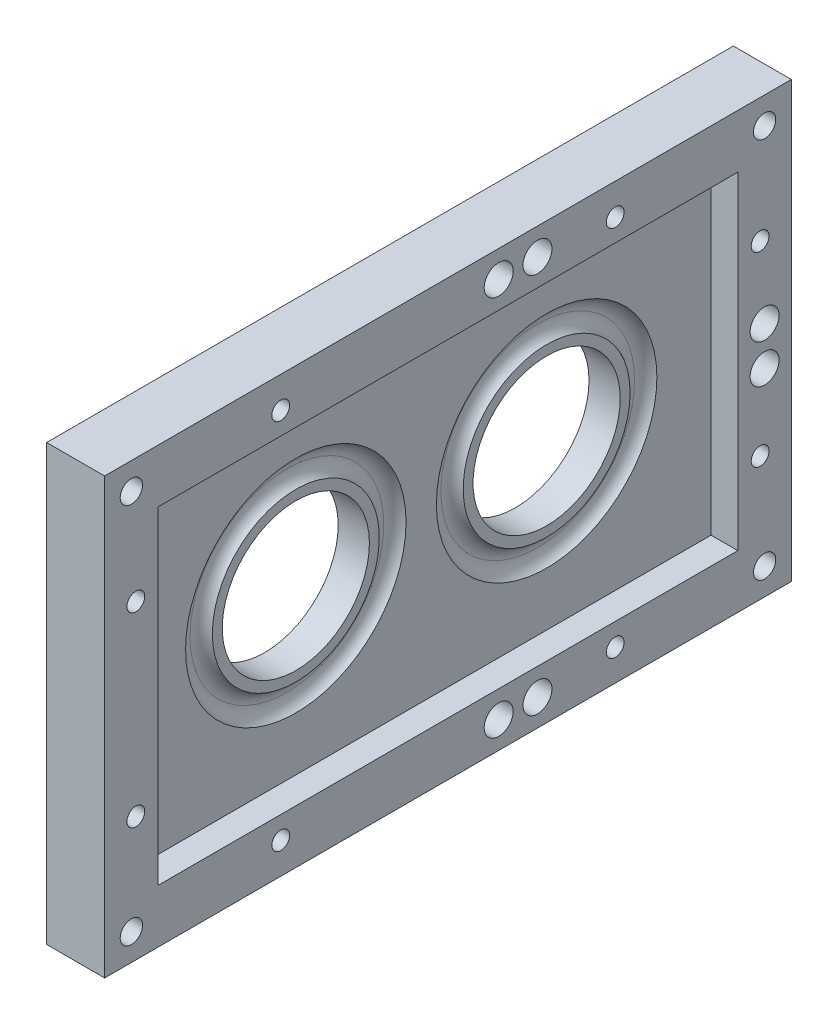
from build123d import *

# Parameters (mm, degrees)
SKETCH1_W           = 130
SKETCH1_H           = 73.5
BOSS_EXTRUDE1_DEPTH = 5
SKETCH2_R           = 24.718
SKETCH2_R_2         = 18.718
CUT_EXTRUDE1_DEPTH  = 2
FILLET1_R           = 3.25
SKETCH3_W           = 10
SKETCH3_H           = 73.5
BOSS_EXTRUDE2_DEPTH = 11
SKETCH4_R           = 2
CUT_EXTRUDE2_DEPTH  = 90.059320119
SKETCH5_R           = 16.5
CUT_EXTRUDE3_DEPTH  = 89.580824674
SKETCH7_W           = 150
SKETCH7_H           = 93.5
SKETCH7_R           = 16.5
SKETCH7_R_2         = 2
BOSS_EXTRUDE3_DEPTH = 2
SKETCH8_R           = 2
CUT_EXTRUDE5_DEPTH  = 90.328396941
SKETCH9_R           = 3.25
CUT_EXTRUDE6_DEPTH  = 6
SKETCH10_W          = 13
SKETCH10_H          = 150
BOSS_EXTRUDE4_DEPTH = 2
SKETCH11_W          = 13
SKETCH11_H          = 150
BOSS_EXTRUDE5_DEPTH = 2
SKETCH12_W          = 13
SKETCH12_H          = 97.5
BOSS_EXTRUDE6_DEPTH = 2
SKETCH13_W          = 13
SKETCH13_H          = 97.5
BOSS_EXTRUDE7_DEPTH = 2
SKETCH14_R          = 2.5
CUT_EXTRUDE7_DEPTH  = 93.057386993
CHAMFER1_SIZE       = 3


with BuildPart() as part:
    # Sketch1 → Boss-Extrude1 (new body)
    with BuildSketch(Plane(origin=(0, 0, 0), x_dir=(0, 0, -1), z_dir=(1, 0, 0))):
        Rectangle(SKETCH1_W, SKETCH1_H)
    extrude(amount=BOSS_EXTRUDE1_DEPTH)

    # Sketch2 → Cut-Extrude1 (cut)
    # profile 1 of 2: a face of its own
    with BuildSketch(Plane(origin=(5, 0, 0), x_dir=(0, 0, -1), z_dir=(1, 0, 0))):
        with Locations((28.125, 0)):
            Circle(SKETCH2_R)
        with Locations((28.125, 0)):
            Circle(SKETCH2_R_2, mode=Mode.SUBTRACT)
    # profile 2 of 2: a face of its own
    with BuildSketch(Plane(origin=(5, 0, 0), x_dir=(0, 0, -1), z_dir=(1, 0, 0))):
        with Locations(Location((-28.125, 0, 0), (0, 0, 180))):
            Circle(SKETCH2_R)
        with Locations(Location((-28.125, 0, 0), (0, 0, 180))):
            Circle(SKETCH2_R_2, mode=Mode.SUBTRACT)
    extrude(amount=-CUT_EXTRUDE1_DEPTH, mode=Mode.SUBTRACT)

    # Fillet1
    # the kernel refuses this fillet: 3.25 mm, written as the material it adds along each edge
    with BuildSketch(Plane(origin=(3, 0, -28.125), x_dir=(0, 0, -1), z_dir=(0, -1, 0))) as fillet1_piece_1:
        with BuildLine():
            CenterArc((21.718, 3.25), FILLET1_R, 270, 67.380135052)
            Line((21.718, 0), (21.718, -0.065))
            Line((21.718, -0.065), (24.718, -0.065))
            Line((24.718, -0.065), (24.783, 0))
            ThreePointArc((24.783, 0), (24.783, 1), (24.778, 1.975))
            Line((24.778, 1.975), (24.718, 2))
        make_face()
    revolve(axis=Axis((3, 0, -28.125), (1, 0, 0)))
    with BuildSketch(Plane(origin=(3, 0, -28.125), x_dir=(0, 0, -1), z_dir=(0, -1, 0))) as fillet1_piece_2:
        with BuildLine():
            CenterArc((21.718, 3.25), FILLET1_R, 202.619864948, 67.380135052)
            Line((18.718, 2), (18.658, 1.975))
            ThreePointArc((18.658, 1.975), (18.653, 1), (18.653, 0))
            Line((18.653, 0), (18.718, -0.065))
            Line((18.718, -0.065), (21.718, -0.065))
            Line((21.718, -0.065), (21.718, 0))
        make_face()
    revolve(axis=Axis((3, 0, -28.125), (1, 0, 0)))
    with BuildSketch(Plane(origin=(3, 0, 28.125), x_dir=(0, 0, 1), z_dir=(0, 1, 0))) as fillet1_piece_3:
        with BuildLine():
            CenterArc((21.718, 3.25), FILLET1_R, 270, 67.380135052)
            Line((21.718, 0), (21.718, -0.065))
            Line((21.718, -0.065), (24.718, -0.065))
            Line((24.718, -0.065), (24.783, 0))
            ThreePointArc((24.783, 0), (24.783, 1), (24.778, 1.975))
            Line((24.778, 1.975), (24.718, 2))
        make_face()
    revolve(axis=Axis((3, 0, 28.125), (1, 0, 0)))
    with BuildSketch(Plane(origin=(3, 0, 28.125), x_dir=(0, 0, 1), z_dir=(0, 1, 0))) as fillet1_piece_4:
        with BuildLine():
            CenterArc((21.718, 3.25), FILLET1_R, 202.619864948, 67.380135052)
            Line((18.718, 2), (18.658, 1.975))
            ThreePointArc((18.658, 1.975), (18.653, 1), (18.653, 0))
            Line((18.653, 0), (18.718, -0.065))
            Line((18.718, -0.065), (21.718, -0.065))
            Line((21.718, -0.065), (21.718, 0))
        make_face()
    revolve(axis=Axis((3, 0, 28.125), (1, 0, 0)))

    # Sketch3 → Boss-Extrude2 (add)
    with BuildSketch(Plane.ZY):
        Polygon((65, 36.75), (75, 36.75), (75, 46.75), (-75, 46.75), (-75, 36.75), (-65, 36.75), align=None)
        with Locations((70, 0)):
            Rectangle(SKETCH3_W, SKETCH3_H)
        Polygon((-65, -36.75), (-75, -36.75), (-75, -46.75), (75, -46.75), (75, -36.75), (65, -36.75), align=None)
        with Locations((-70, 0)):
            Rectangle(SKETCH3_W, SKETCH3_H)
    extrude(amount=-BOSS_EXTRUDE2_DEPTH)

    # Sketch4 → Cut-Extrude2 (cut, through all)
    with BuildSketch(Plane(origin=(11, 0, 0), x_dir=(0, 0, -1), z_dir=(1, 0, 0))):
        with Locations((-37.5, 41.75)):
            Circle(SKETCH4_R)
        with Locations((37.5, 41.75)):
            Circle(SKETCH4_R)
        with Locations((70, 20.875)):
            Circle(SKETCH4_R)
        with Locations(Location((-37.5, -41.75, 0), (0, 0, 180))):
            Circle(SKETCH4_R)
        with Locations(Location((37.5, -41.75, 0), (0, 0, 180))):
            Circle(SKETCH4_R)
        with Locations((70, -20.875)):
            Circle(SKETCH4_R)
        with Locations(Location((-70, 20.875, 0), (0, 0, 180))):
            Circle(SKETCH4_R)
        with Locations(Location((-70, -20.875, 0), (0, 0, 180))):
            Circle(SKETCH4_R)
    extrude(amount=-CUT_EXTRUDE2_DEPTH, mode=Mode.SUBTRACT)

    # Sketch5 → Cut-Extrude3 (cut, through all)
    with BuildSketch(Plane(origin=(5, 0, 0), x_dir=(0, 0, -1), z_dir=(1, 0, 0))):
        with Locations((-28.125, 0)):
            Circle(SKETCH5_R)
        with Locations((28.125, 0)):
            Circle(SKETCH5_R)
    extrude(amount=-CUT_EXTRUDE3_DEPTH, mode=Mode.SUBTRACT)

    # Sketch7 → Boss-Extrude3 (add)
    with BuildSketch(Plane.ZY):
        Rectangle(SKETCH7_W, SKETCH7_H)
        with Locations(Location((28.125, 0, 0), (0, 0, 180))):
            Circle(SKETCH7_R, mode=Mode.SUBTRACT)
        with Locations(Location((-28.125, 0, 0), (0, 0, 180))):
            Circle(SKETCH7_R, mode=Mode.SUBTRACT)
        with Locations(Location((-70, 20.875, 0), (0, 0, 180))):
            Circle(SKETCH7_R_2, mode=Mode.SUBTRACT)
        with Locations(Location((-70, -20.875, 0), (0, 0, 180))):
            Circle(SKETCH7_R_2, mode=Mode.SUBTRACT)
        with Locations((-37.5, -41.75)):
            Circle(SKETCH7_R_2, mode=Mode.SUBTRACT)
        with Locations((37.5, -41.75)):
            Circle(SKETCH7_R_2, mode=Mode.SUBTRACT)
        with Locations((70, -20.875)):
            Circle(SKETCH7_R_2, mode=Mode.SUBTRACT)
        with Locations((70, 20.875)):
            Circle(SKETCH7_R_2, mode=Mode.SUBTRACT)
        with Locations(Location((-37.5, 41.75, 0), (0, 0, 180))):
            Circle(SKETCH7_R_2, mode=Mode.SUBTRACT)
        with Locations(Location((37.5, 41.75, 0), (0, 0, 180))):
            Circle(SKETCH7_R_2, mode=Mode.SUBTRACT)
    extrude(amount=BOSS_EXTRUDE3_DEPTH)

    # Sketch8 → Cut-Extrude5 (cut, through all)
    with BuildSketch(Plane(origin=(11, 0, 0), x_dir=(0, 0, -1), z_dir=(1, 0, 0))):
        with Locations((11.37, 42.75)):
            Circle(SKETCH8_R)
        with Locations((20.07, 42.75)):
            Circle(SKETCH8_R)
        with Locations((11.37, -42.75)):
            Circle(SKETCH8_R)
        with Locations((20.07, -42.75)):
            Circle(SKETCH8_R)
        with Locations((71, 4.35)):
            Circle(SKETCH8_R)
        with Locations((71, -4.35)):
            Circle(SKETCH8_R)
    extrude(amount=-CUT_EXTRUDE5_DEPTH, mode=Mode.SUBTRACT)

    # Sketch9 → Cut-Extrude6 (cut)
    with BuildSketch(Plane(origin=(11, 0, 0), x_dir=(0, 0, -1), z_dir=(1, 0, 0))):
        with Locations((20.07, 42.75)):
            Circle(SKETCH9_R)
        with Locations((11.37, 42.75)):
            Circle(SKETCH9_R)
        with Locations((71, 4.35)):
            Circle(SKETCH9_R)
        with Locations((71, -4.35)):
            Circle(SKETCH9_R)
        with Locations((20.07, -42.75)):
            Circle(SKETCH9_R)
        with Locations((11.37, -42.75)):
            Circle(SKETCH9_R)
    extrude(amount=-CUT_EXTRUDE6_DEPTH, mode=Mode.SUBTRACT)

    # Sketch10 → Boss-Extrude4 (add)
    with BuildSketch(Plane(origin=(0, 46.75, 0), x_dir=(1, 0, 0), z_dir=(0, 1, 0))):
        with Locations((4.5, 0)):
            Rectangle(SKETCH10_W, SKETCH10_H)
    extrude(amount=BOSS_EXTRUDE4_DEPTH)

    # Sketch11 → Boss-Extrude5 (add)
    with BuildSketch(Plane.XZ.offset(46.75)):
        with Locations((4.5, 0)):
            Rectangle(SKETCH11_W, SKETCH11_H)
    extrude(amount=BOSS_EXTRUDE5_DEPTH)

    # Sketch12 → Boss-Extrude6 (add)
    with BuildSketch(Plane(origin=(0, 0, -75), x_dir=(-1, 0, 0), z_dir=(0, 0, -1))):
        with Locations((-4.5, 0)):
            Rectangle(SKETCH12_W, SKETCH12_H)
    extrude(amount=BOSS_EXTRUDE6_DEPTH)

    # Sketch13 → Boss-Extrude7 (add)
    with BuildSketch(Plane.XY.offset(75)):
        with Locations((4.5, 0)):
            Rectangle(SKETCH13_W, SKETCH13_H)
    extrude(amount=BOSS_EXTRUDE7_DEPTH)

    # Sketch14 → Cut-Extrude7 (cut, through all)
    with BuildSketch(Plane(origin=(11, 0, 0), x_dir=(0, 0, -1), z_dir=(1, 0, 0))):
        with Locations((71, 42.75)):
            Circle(SKETCH14_R)
        with Locations((-71, 42.75)):
            Circle(SKETCH14_R)
        with Locations((-71, -42.75)):
            Circle(SKETCH14_R)
        with Locations((71, -42.75)):
            Circle(SKETCH14_R)
    extrude(amount=-CUT_EXTRUDE7_DEPTH, mode=Mode.SUBTRACT)

    # Chamfer1
    chamfer1_edges = [part.edges().sort_by_distance(p)[0] for p in [
        (-2, -42.75, -68.5),
        (-2, -42.75, 73.5),
        (-2, 42.75, 73.5),
        (-2, 42.75, -68.5),
    ]]
    chamfer(chamfer1_edges, length=CHAMFER1_SIZE)


solid = part.part
